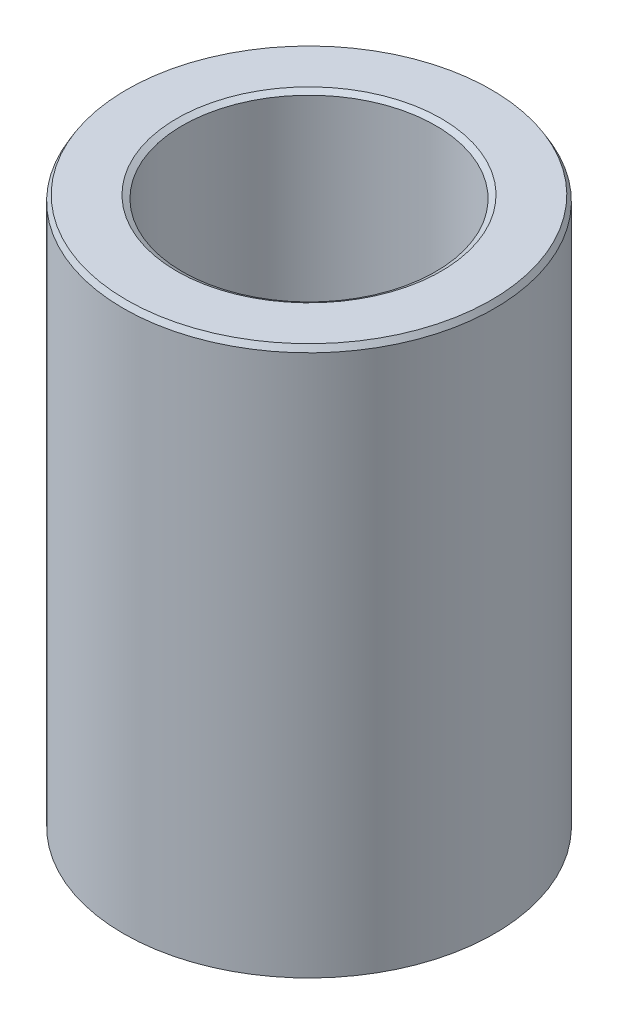
from build123d import *
from OCP.BRepFilletAPI import BRepFilletAPI_MakeChamfer

# Parameters (mm, degrees)
SKETCH1_R           = 52.5
BOSS_EXTRUDE1_DEPTH = 155.70058296
SKETCH2_R           = 35.8309577
CUT_EXTRUDE1_DEPTH  = 173.496873983
CHAMFER1_SIZE       = 1.593367446
CHAMFER1_SIZE2      = 0.919931124


with BuildPart() as part:
    # Sketch1 → Boss-Extrude1 (new body)
    with BuildSketch(Plane(origin=(0, 0, 0), x_dir=(1, 0, 0), z_dir=(0, 1, 0))):
        Circle(SKETCH1_R)
    extrude(amount=BOSS_EXTRUDE1_DEPTH)

    # Sketch2 → Cut-Extrude1 (cut, through all)
    with BuildSketch(Plane(origin=(0, 0, 0), x_dir=(1, 0, 0), z_dir=(0, 1, 0))):
        Circle(SKETCH2_R)
    extrude(amount=CUT_EXTRUDE1_DEPTH, mode=Mode.SUBTRACT)

    # Chamfer1: one chamfer whose edges measure the first distance from different faces: ONE call of the kernel's chamfer builder (chamfer() names one face for all edges)
    chamfer1_edges_1 = [part.edges().sort_by_distance(p)[0] for p in [
        (-35.8309577, 155.70058296, 0),
    ]]
    chamfer1_side_1 = [part.faces().sort_by_distance(p)[0] for p in [
        (-51.01507576, 155.70058296, 0),
    ]]
    chamfer1_edges_2 = [part.edges().sort_by_distance(p)[0] for p in [
        (-35.8309577, 0, 0),
    ]]
    chamfer1_side_2 = [part.faces().sort_by_distance(p)[0] for p in [
        (-35.8309577, 77.85029148, 0),
    ]]
    chamfer1_edges_3 = [part.edges().sort_by_distance(p)[0] for p in [
        (-52.5, 0, 0),
    ]]
    chamfer1_side_3 = [part.faces().sort_by_distance(p)[0] for p in [
        (-51.01507576, 0, 0),
    ]]
    chamfer1_edges_4 = [part.edges().sort_by_distance(p)[0] for p in [
        (-52.5, 155.70058296, 0),
    ]]
    chamfer1_side_4 = [part.faces().sort_by_distance(p)[0] for p in [
        (-52.5, 77.85029148, 0),
    ]]
    chamfer1 = BRepFilletAPI_MakeChamfer(part.part.solid().wrapped)
    for e in chamfer1_edges_1:
        chamfer1.Add(CHAMFER1_SIZE, CHAMFER1_SIZE2, e.wrapped, chamfer1_side_1[0].wrapped)  # the first distance lies on this face
    for e in chamfer1_edges_2:
        chamfer1.Add(CHAMFER1_SIZE, CHAMFER1_SIZE2, e.wrapped, chamfer1_side_2[0].wrapped)  # the first distance lies on this face
    for e in chamfer1_edges_3:
        chamfer1.Add(CHAMFER1_SIZE, CHAMFER1_SIZE2, e.wrapped, chamfer1_side_3[0].wrapped)  # the first distance lies on this face
    for e in chamfer1_edges_4:
        chamfer1.Add(CHAMFER1_SIZE, CHAMFER1_SIZE2, e.wrapped, chamfer1_side_4[0].wrapped)  # the first distance lies on this face
    add(Compound.cast(chamfer1.Shape()), mode=Mode.REPLACE)


solid = part.part
